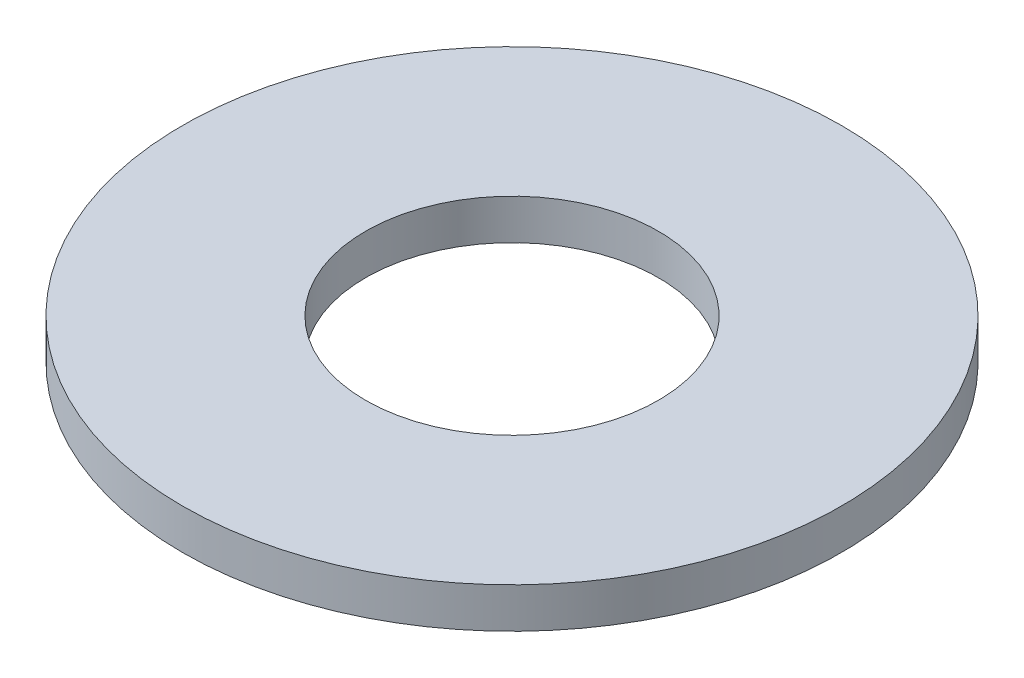
from build123d import *

# Parameters (mm, degrees)
SKETCH1_R           = 90
BOSS_EXTRUDE1_DEPTH = 11
SKETCH2_R           = 40
CUT_EXTRUDE1_DEPTH  = 128.753669223


with BuildPart() as part:
    # Sketch1 → Boss-Extrude1 (new body)
    with BuildSketch(Plane(origin=(0, 0, 0), x_dir=(1, 0, 0), z_dir=(0, 1, 0))):
        Circle(SKETCH1_R)
    extrude(amount=BOSS_EXTRUDE1_DEPTH)

    # Sketch2 → Cut-Extrude1 (cut, through all)
    with BuildSketch(Plane(origin=(0, 0, 0), x_dir=(1, 0, 0), z_dir=(0, 1, 0))):
        Circle(SKETCH2_R)
    extrude(amount=CUT_EXTRUDE1_DEPTH, mode=Mode.SUBTRACT)


solid = part.part
